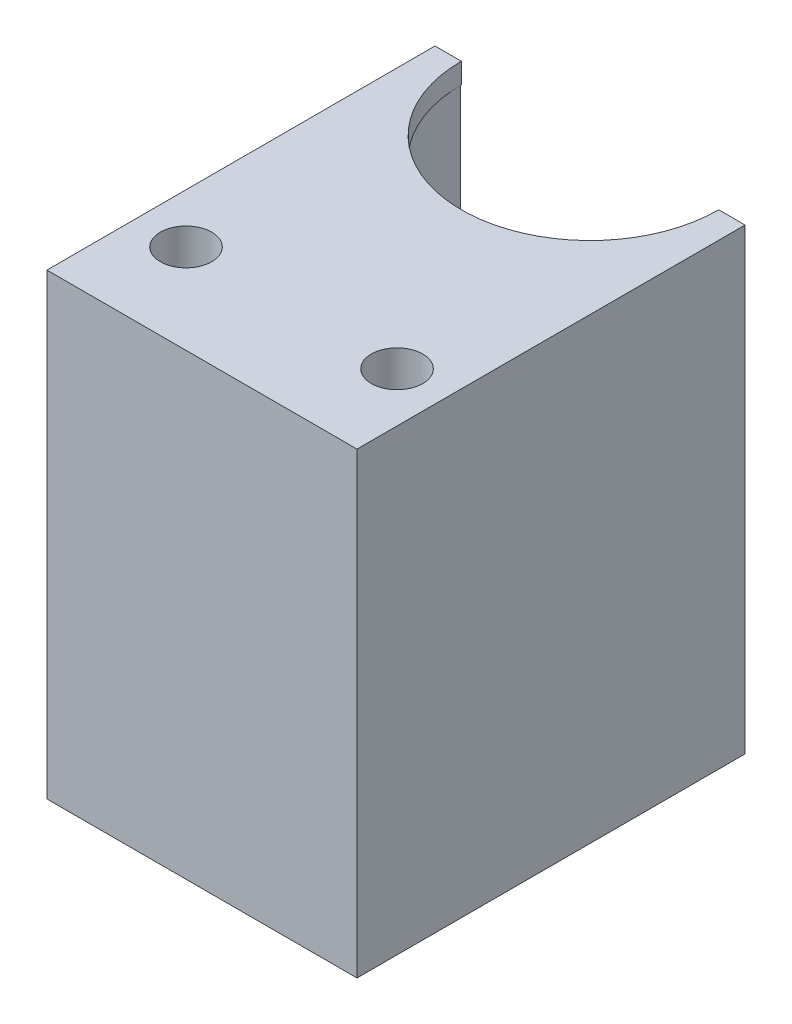
from build123d import *

# Parameters (mm, degrees)
BOSS_EXTRUDE1_DEPTH = 32.5
SKETCH4_R           = 1.05
BOSS_EXTRUDE2_DEPTH = 2
SKETCH7_R           = 2.495
BOSS_EXTRUDE5_DEPTH = 2
SKETCH8_W           = 30.122
SKETCH8_H           = 37.7
SKETCH8_R           = 2.495
BOSS_EXTRUDE6_DEPTH = 2
SKETCH5_R           = 1.05
BOSS_EXTRUDE3_DEPTH = 2
SKETCH9_R           = 2.495
BOSS_EXTRUDE7_DEPTH = 2
SKETCH10_W          = 30.122
SKETCH10_H          = 37.7
SKETCH10_R          = 2.495
BOSS_EXTRUDE8_DEPTH = 2
SKETCH11_R          = 12.5
CUT_EXTRUDE1_DEPTH  = 61.235983606


with BuildPart() as part:
    # Sketch2 → Boss-Extrude1 (new body)
    with BuildSketch(Plane(origin=(0, 0, 0), x_dir=(1, 0, 0), z_dir=(0, 1, 0))):
        Polygon((15.061, 0), (15.061, 37.7), (12.561, 37.7), (12.561, 2.5), (-12.561, 2.5), (-12.561, 37.7), (-15.061, 37.7), (-15.061, 0), align=None)
    extrude(amount=BOSS_EXTRUDE1_DEPTH)

    # Sketch4 → Boss-Extrude2 (add)
    with BuildSketch(Plane.XZ):
        Polygon((-15.061, 0), (-15.061, -7.443777264), (-15.061, -37.7), (-12.561, -37.7), (-12.561, -7.5), (12.561, -7.5), (12.561, -37.7), (15.061, -37.7), (15.061, -7.443777264), (15.061, 0), align=None)
        with Locations((-10.2499, -4.95)):
            Circle(SKETCH4_R, mode=Mode.SUBTRACT)
        with Locations((10.2499, -4.95)):
            Circle(SKETCH4_R, mode=Mode.SUBTRACT)
    extrude(amount=BOSS_EXTRUDE2_DEPTH)

    # Sketch7 → Boss-Extrude5 (add)
    with BuildSketch(Plane.XZ.offset(2)):
        Polygon((-15.061, 0), (-15.061, -37.7), (-12.561, -37.7), (-12.561, -7.5), (12.561, -7.5), (12.561, -37.7), (15.061, -37.7), (15.061, 0), align=None)
        with Locations((-10.2499, -4.95)):
            Circle(SKETCH7_R, mode=Mode.SUBTRACT)
        with Locations((10.2499, -4.95)):
            Circle(SKETCH7_R, mode=Mode.SUBTRACT)
    extrude(amount=BOSS_EXTRUDE5_DEPTH)

    # Sketch8 → Boss-Extrude6 (add)
    with BuildSketch(Plane.XZ.offset(4)):
        with Locations((0, -18.85)):
            Rectangle(SKETCH8_W, SKETCH8_H)
        with Locations((-10.2499, -4.95)):
            Circle(SKETCH8_R, mode=Mode.SUBTRACT)
        with Locations((10.2499, -4.95)):
            Circle(SKETCH8_R, mode=Mode.SUBTRACT)
    extrude(amount=BOSS_EXTRUDE6_DEPTH)

    # Sketch5 → Boss-Extrude3 (add)
    with BuildSketch(Plane(origin=(0, 32.5, 0), x_dir=(1, 0, 0), z_dir=(0, 1, 0))):
        Polygon((-7.5, 10), (-7.5, 2.5), (7.5, 2.5), (7.5, 10), (10.2499, 12), (12.561, 12), (12.561, 37.7), (15.061, 37.7), (15.061, 0), (-15.061, 0), (-15.061, 37.7), (-12.561, 37.7), (-12.561, 12), (-10.2499, 12), align=None)
        with Locations((-10.2499, 8.7)):
            Circle(SKETCH5_R, mode=Mode.SUBTRACT)
        with Locations((10.2499, 8.7)):
            Circle(SKETCH5_R, mode=Mode.SUBTRACT)
    extrude(amount=BOSS_EXTRUDE3_DEPTH)

    # Sketch9 → Boss-Extrude7 (add)
    with BuildSketch(Plane(origin=(0, 34.5, 0), x_dir=(1, 0, 0), z_dir=(0, 1, 0))):
        Polygon((-15.061, 0), (-15.061, 37.7), (-12.561, 37.7), (-12.561, 12), (-10.2499, 12), (-7.5, 10), (-7.5, 2.5), (7.5, 2.5), (7.5, 10), (10.2499, 12), (12.561, 12), (12.561, 37.7), (15.061, 37.7), (15.061, 0), align=None)
        with Locations((-10.2499, 8.7)):
            Circle(SKETCH9_R, mode=Mode.SUBTRACT)
        with Locations((10.2499, 8.7)):
            Circle(SKETCH9_R, mode=Mode.SUBTRACT)
    extrude(amount=BOSS_EXTRUDE7_DEPTH)

    # Sketch10 → Boss-Extrude8 (add)
    with BuildSketch(Plane(origin=(0, 36.5, 0), x_dir=(1, 0, 0), z_dir=(0, 1, 0))):
        with Locations((0, 18.85)):
            Rectangle(SKETCH10_W, SKETCH10_H)
        with Locations((-10.2499, 8.7)):
            Circle(SKETCH10_R, mode=Mode.SUBTRACT)
        with Locations((10.2499, 8.7)):
            Circle(SKETCH10_R, mode=Mode.SUBTRACT)
    extrude(amount=BOSS_EXTRUDE8_DEPTH)

    # Sketch11 → Cut-Extrude1 (cut, through all)
    with BuildSketch(Plane(origin=(0, 38.5, 0), x_dir=(1, 0, 0), z_dir=(0, 1, 0))):
        with Locations((0, 37.7)):
            Circle(SKETCH11_R)
    extrude(amount=-CUT_EXTRUDE1_DEPTH, mode=Mode.SUBTRACT)


solid = part.part
